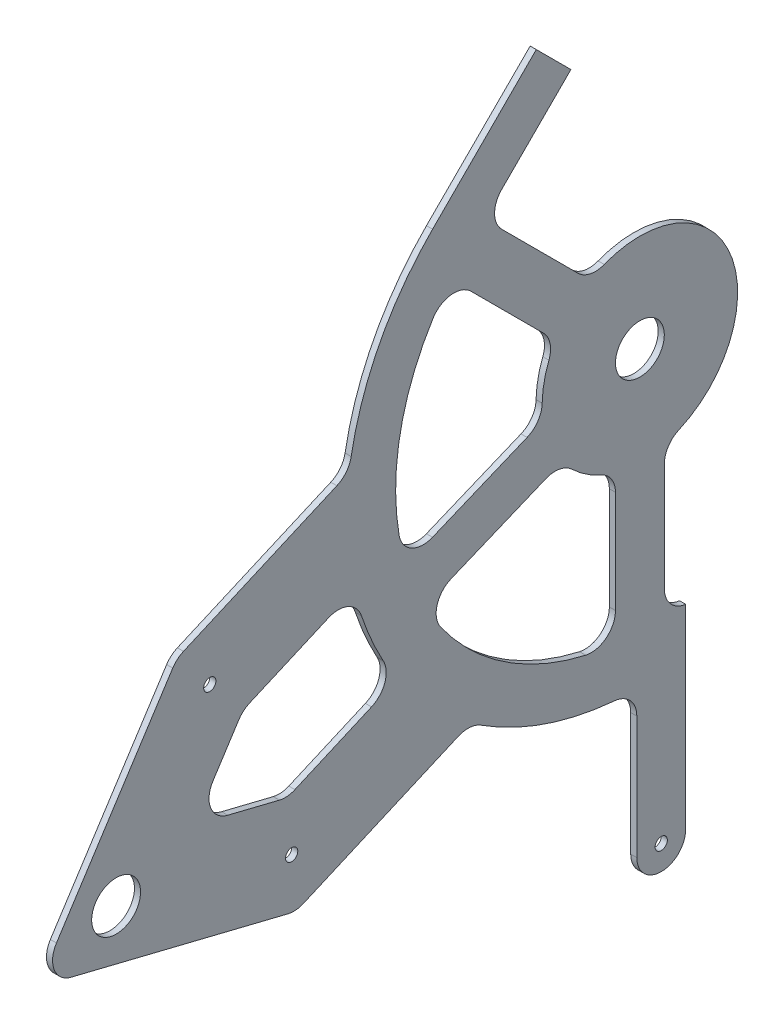
from build123d import *

# Parameters (mm, degrees)
BOSS_EXTRUDE2_DEPTH     = 3.175
SKETCH11_W              = 76.2
SKETCH11_H              = 25.436159883
BOSS_EXTRUDE4_DEPTH     = 3.175
SKETCH12_R              = 3.175
BOSS_EXTRUDE5_DEPTH     = 3.175
SKETCH13_R              = 3.175
SKETCH13_R_2            = 12.7
BOSS_EXTRUDE6_DEPTH     = 3.175
FILLET1_R               = 12.7
SKETCH14_R              = 12.7
BOSS_EXTRUDE7_DEPTH     = 3.175
FILLET2_R               = 12.7
CUT_EXTRUDE1_DEPTH      = 389.871002829
CUT_EXTRUDE1_DEPTH_BACK = 389.871002829


with BuildPart() as part:
    # Sketch9 → Boss-Extrude2 (new body)
    with BuildSketch(Plane(origin=(0, 0, 0), x_dir=(0, 0, -1), z_dir=(1, 0, 0))):
        with BuildLine():
            Line((0, -126.954378983), (0, -152.390538866))
            ThreePointArc((0, -152.390538866), (-140.790499807, -58.317334473), (-107.756383421, 107.756383421))
            Line((-107.756383421, 107.756383421), (-53.840601545, 161.672165297))
            Line((-53.840601545, 161.672165297), (-35.854520405, 143.686084156))
            Line((-35.854520405, 143.686084156), (-89.770302281, 89.770302281))
            ThreePointArc((-89.770302281, 89.770302281), (-117.290552306, -48.583337503), (0, -126.954378983))
        make_face()
    extrude(amount=BOSS_EXTRUDE2_DEPTH)

    # Sketch11 → Boss-Extrude4 (add)
    with BuildSketch(Plane(origin=(0, 0, 0), x_dir=(0, 0, -1), z_dir=(1, 0, 0))):
        with Locations((38.1, -139.672458925)):
            Rectangle(SKETCH11_W, SKETCH11_H)
    extrude(amount=BOSS_EXTRUDE4_DEPTH)

    # Sketch12 → Boss-Extrude5 (add)
    with BuildSketch(Plane(origin=(0, 0, 0), x_dir=(0, 0, -1), z_dir=(1, 0, 0))):
        with BuildLine():
            ThreePointArc((-1.596710848, -228.181271676), (11.103289152, -240.881271676), (23.803289152, -228.181271676))
            Line((23.803289152, -228.181271676), (23.803289152, -152.390538866))
            Line((23.803289152, -152.390538866), (0, -152.390538866))
            ThreePointArc((0, -152.390538866), (-0.79836638, -152.388447551), (-1.596710848, -152.382173664))
            Line((-1.596710848, -152.382173664), (-1.596710848, -228.181271676))
        make_face()
        with Locations((11.103289152, -228.181271676)):
            Circle(SKETCH12_R, mode=Mode.SUBTRACT)
    extrude(amount=BOSS_EXTRUDE5_DEPTH)

    # Sketch13 → Boss-Extrude6 (add)
    with BuildSketch(Plane(origin=(0, 0, 0), x_dir=(0, 0, -1), z_dir=(1, 0, 0))):
        with BuildLine():
            Line((-179.30408176, -108.723426383), (-126.094112121, -85.5754125))
            ThreePointArc((-126.094112121, -85.5754125), (-108.798735519, -106.703849441), (-88.010513932, -124.40669505))
            Line((-88.010513932, -124.40669505), (-174.796678153, -162.161411842))
            ThreePointArc((-174.796678153, -162.161411842), (-178.795504512, -163.170744037), (-182.906900508, -162.845495368))
            Line((-182.906900508, -162.845495368), (-295.609075895, -135.021776789))
            ThreePointArc((-295.609075895, -135.021776789), (-304.370626338, -127.373828039), (-303.232212873, -115.799723277))
            Line((-303.232212873, -115.799723277), (-242.800623961, -22.269934128))
            ThreePointArc((-242.800623961, -22.269934128), (-240.351404734, -19.479383865), (-237.199783408, -17.516445097))
            Line((-237.199783408, -17.516445097), (-151.079200391, 19.948722893))
            ThreePointArc((-151.079200391, 19.948722893), (-152.215522716, -7.301436858), (-148.476160922, -34.317720989))
            Line((-148.476160922, -34.317720989), (-202.860740085, -57.976727036))
            ThreePointArc((-202.860740085, -57.976727036), (-206.012361411, -59.939665804), (-208.461580638, -62.730216067))
            Line((-208.461580638, -62.730216067), (-221.913851047, -83.550254686))
            ThreePointArc((-221.913851047, -83.550254686), (-223.052264512, -95.124359447), (-214.290714069, -102.772308198))
            Line((-214.290714069, -102.772308198), (-187.414304116, -109.407509908))
            ThreePointArc((-187.414304116, -109.407509908), (-183.30290812, -109.732758578), (-179.30408176, -108.723426383))
        make_face()
        with Locations((-180.989788445, -137.156185968)):
            Circle(SKETCH13_R, mode=Mode.SUBTRACT)
        with Locations((-272.235522473, -114.629596607)):
            Circle(SKETCH13_R_2, mode=Mode.SUBTRACT)
        with Locations((-223.548763187, -39.27724509)):
            Circle(SKETCH13_R, mode=Mode.SUBTRACT)
    extrude(amount=BOSS_EXTRUDE6_DEPTH)

    # Fillet1
    fillet1_edges = [part.edges().sort_by_distance(p)[0] for p in [
        (1.5875, -34.317720989, 148.476160922),
        (1.5875, -85.5754125, 126.094112121),
        (1.5875, -124.40669505, 88.010513932),
        (1.5875, -152.382173664, 1.596710848),
        (1.5875, -152.390538866, -23.803289152),
        (1.5875, 19.948722893, 151.079200391),
    ]]
    fillet(fillet1_edges, radius=FILLET1_R)

    # Sketch14 → Boss-Extrude7 (add)
    with BuildSketch(Plane(origin=(0, 0, 0), x_dir=(0, 0, -1), z_dir=(1, 0, 0))):
        with BuildLine():
            Line((-25.800126281, 43.760638523), (-80.790046159, 98.750558402))
            Line((-80.790046159, 98.750558402), (-89.770302281, 89.770302281))
            ThreePointArc((-89.770302281, 89.770302281), (-94.153425206, 85.161886223), (-98.300254842, 80.3397426))
            Line((-98.300254842, 80.3397426), (-43.760638523, 25.800126281))
            ThreePointArc((-43.760638523, 25.800126281), (-49.823892244, 9.910588358), (-50.302839141, -7.089737254))
            Line((-50.302839141, -7.089737254), (-121.562281943, -36.60636491))
            ThreePointArc((-121.562281943, -36.60636491), (-117.290552306, -48.583337503), (-111.842122761, -60.072905036))
            Line((-111.842122761, -60.072905036), (-40.582679959, -30.55627738))
            ThreePointArc((-40.582679959, -30.55627738), (-28.222967837, -42.238656305), (-12.7, -49.186888497))
            Line((-12.7, -49.186888497), (-12.7, -126.317553583))
            ThreePointArc((-12.7, -126.317553583), (-6.357978189, -126.795072682), (0, -126.954378983))
            Line((0, -126.954378983), (12.7, -126.954378983))
            Line((12.7, -126.954378983), (12.7, -49.186888497))
            ThreePointArc((12.7, -49.186888497), (46.933080252, 19.440318364), (-25.800126281, 43.760638523))
        make_face()
        Circle(SKETCH14_R, mode=Mode.SUBTRACT)
    extrude(amount=BOSS_EXTRUDE7_DEPTH)

    # Fillet2
    fillet2_edges = [part.edges().sort_by_distance(p)[0] for p in [
        (1.5875, -7.089737254, 50.302839141),
        (1.5875, 25.800126281, 43.760638523),
        (1.5875, 80.3397426, 98.300254842),
        (1.5875, -36.60636491, 121.562281943),
        (1.5875, -60.072905036, 111.842122761),
        (1.5875, -30.55627738, 40.582679959),
        (1.5875, -49.186888497, 12.7),
        (1.5875, -126.317553583, 12.7),
        (1.5875, -126.954378983, -12.7),
        (1.5875, -49.186888497, -12.7),
        (1.5875, 43.760638523, 25.800126281),
        (1.5875, 98.750558402, 80.790046159),
    ]]
    fillet(fillet2_edges, radius=FILLET2_R)

    # Sketch15 → Cut-Extrude1 (cut, two sides: drawn at the far end of the back side and taken through both)
    with BuildSketch(Plane(origin=(3.175, 0, 0), x_dir=(0, 0, -1), z_dir=(1, 0, 0)).offset(-CUT_EXTRUDE1_DEPTH_BACK)):
        with BuildLine():
            Line((23.803289152, -165.090538866), (23.803289152, -126.853605724))
            Line((23.803289152, -126.853605724), (76.2, -126.954378983))
            Line((76.2, -126.954378983), (76.2, -152.390538866))
            Line((76.2, -152.390538866), (36.503289152, -152.390538866))
            ThreePointArc((36.503289152, -152.390538866), (27.523033031, -156.110282745), (23.803289152, -165.090538866))
        make_face()
    extrude(amount=CUT_EXTRUDE1_DEPTH + CUT_EXTRUDE1_DEPTH_BACK, mode=Mode.SUBTRACT)


solid = part.part
